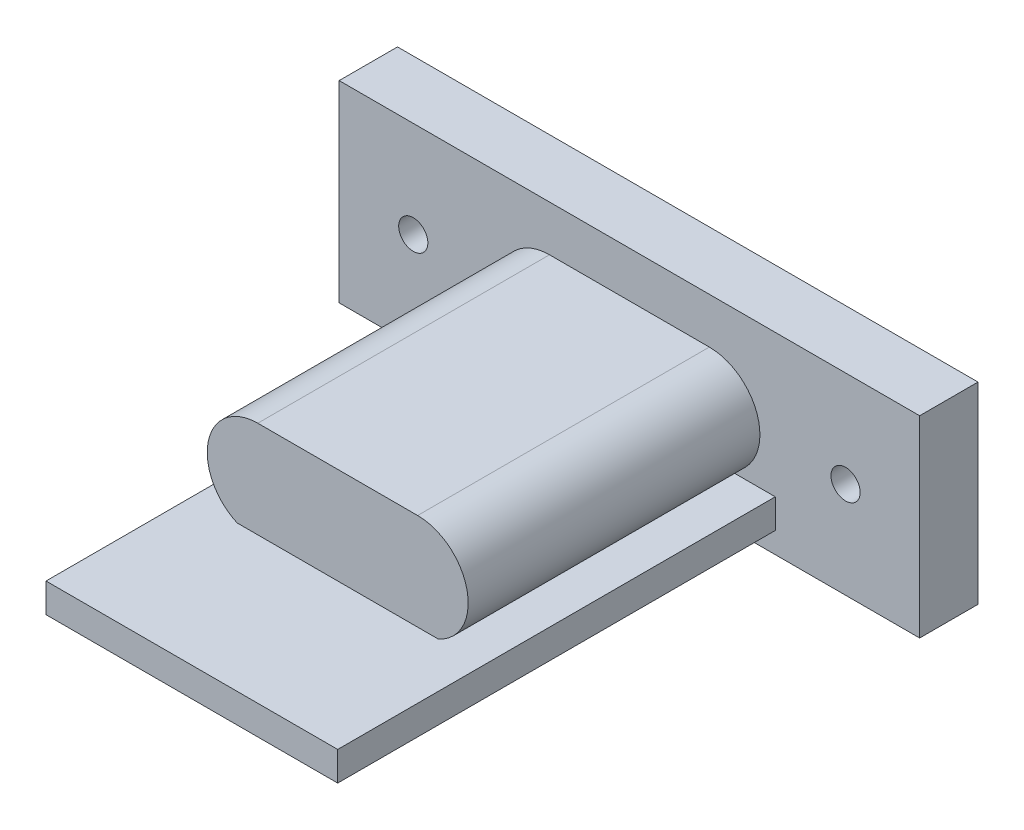
from build123d import *

# Parameters (mm, degrees)
SKETCH1_W            = 19.9
SKETCH1_H            = 6.6
SKETCH1_R            = 0.5
BOSS_EXTRUDE1_DEPTH  = 2
BOSS_EXTRUDE11_DEPTH = 10
BOSS_EXTRUDE12_START = -1
BOSS_EXTRUDE12_DEPTH = 1
SKETCH8_W            = 10
SKETCH8_H            = 1
BOSS_EXTRUDE13_DEPTH = 5


with BuildPart() as part:
    # Sketch1 → Boss-Extrude1 (new body)
    with BuildSketch(Plane.XY):
        with Locations((9.95, 3.3)):
            Rectangle(SKETCH1_W, SKETCH1_H)
        with Locations((2.54, 3.3)):
            Circle(SKETCH1_R, mode=Mode.SUBTRACT)
        with Locations((17.36, 3.3)):
            Circle(SKETCH1_R, mode=Mode.SUBTRACT)
        with BuildLine():
            Line((7.21, 4.88), (12.69, 4.88))
            ThreePointArc((12.69, 4.88), (14.27, 3.3), (12.69, 1.72))
            Line((12.69, 1.72), (7.21, 1.72))
            ThreePointArc((7.21, 1.72), (5.63, 3.3), (7.21, 4.88))
        make_face(mode=Mode.SUBTRACT)
    extrude(amount=BOSS_EXTRUDE1_DEPTH)

    # Sketch6 → Boss-Extrude11 (add)
    with BuildSketch(Plane.XY.offset(2)):
        with BuildLine():
            Line((7.21, 5.033060679), (12.69, 5.033060679))
            ThreePointArc((12.69, 5.033060679), (14.384837637, 3.661973344), (13.397979882, 1.718145455))
            Line((13.397979882, 1.718145455), (14.95, 1.718145455))
            Line((14.95, 1.718145455), (14.95, 0.718145455))
            Line((14.95, 0.718145455), (4.95, 0.718145455))
            Line((4.95, 0.718145455), (4.95, 1.718145455))
            Line((4.95, 1.718145455), (6.502020118, 1.718145455))
            ThreePointArc((6.502020118, 1.718145455), (5.515162363, 3.661973344), (7.21, 5.033060679))
        make_face()
        with BuildLine():
            Line((7.21, 4.57), (12.69, 4.57))
            ThreePointArc((12.69, 4.57), (13.96, 3.3), (12.69, 2.03))
            Line((12.69, 2.03), (7.21, 2.03))
            ThreePointArc((7.21, 2.03), (5.94, 3.3), (7.21, 4.57))
        make_face(mode=Mode.SUBTRACT)
    extrude(amount=BOSS_EXTRUDE11_DEPTH)

    # Sketch7 → Boss-Extrude12 (add)
    with BuildSketch(Plane.XY.offset(12).offset(BOSS_EXTRUDE12_START)):
        with BuildLine():
            Line((7.21, 5.033060679), (12.69, 5.033060679))
            ThreePointArc((12.69, 5.033060679), (14.423060679, 3.3), (12.69, 1.566939321))
            Line((12.69, 1.566939321), (7.21, 1.566939321))
            ThreePointArc((7.21, 1.566939321), (5.476939321, 3.3), (7.21, 5.033060679))
        make_face()
    extrude(amount=BOSS_EXTRUDE12_DEPTH)

    # Sketch8 → Boss-Extrude13 (add)
    with BuildSketch(Plane.XY.offset(12)):
        with Locations((9.95, 1.218145455)):
            Rectangle(SKETCH8_W, SKETCH8_H)
    extrude(amount=BOSS_EXTRUDE13_DEPTH)


solid = part.part
